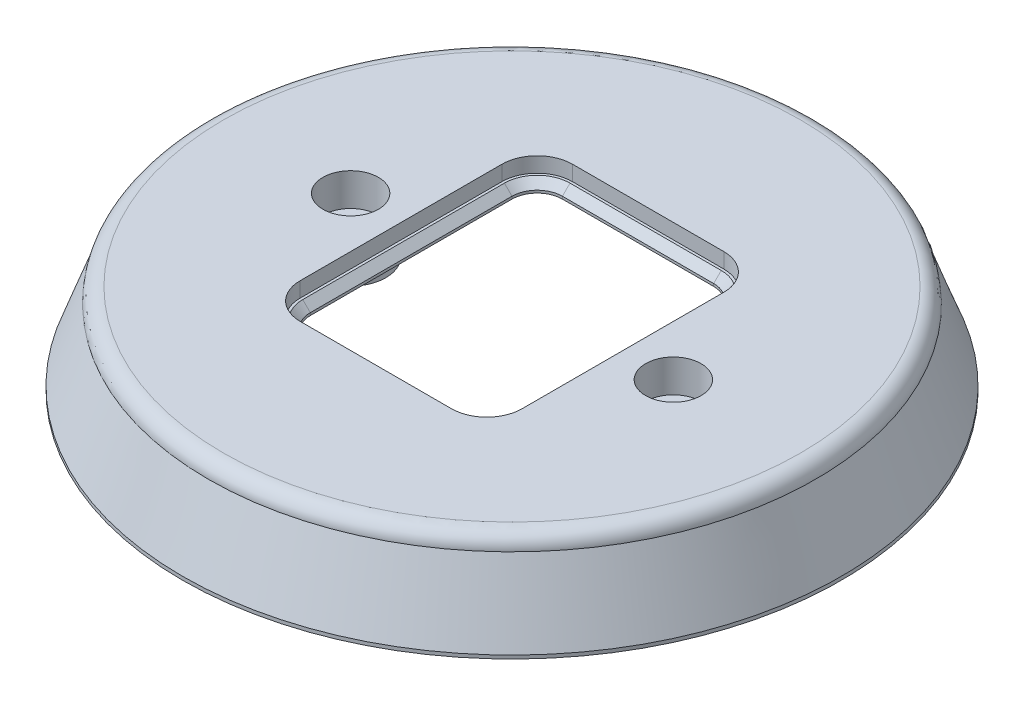
from build123d import *

# Parameters (mm, degrees)
CORTAR_EXTRUIR1_REACH   = 95.608
CROQUIS2_R              = 3.5
CROQUIS3_R              = 7
CROQUIS3_R_2            = 3.5
SALIENTE_EXTRUIR1_DEPTH = 6
SALIENTE_EXTRUIR2_START = 3
CROQUIS4_R              = 60.229990605
CROQUIS4_R_2            = 3.5
SALIENTE_EXTRUIR2_DEPTH = 3
CROQUIS5_R              = 5.5
CORTAR_EXTRUIR2_DEPTH   = 6.5
CORTAR_EXTRUIR3_REACH   = 96.128
CORTAR_EXTRUIR4_DEPTH   = 3
CHAFL_N1_SIZE           = 1.5
REDONDEO1_R             = 3


with BuildPart() as part:
    # Croquis1 → Revolución1 (revolve)
    with BuildSketch(Plane.XY, mode=Mode.PRIVATE) as revoluci_n1_sk:
        Polygon((-65.360292755, 76.904610688), (-65.360292755, 76.220570402), (-63.480907514, 76.220570402), (-58.829575529, 89), (0, 89), (0, 91), (-60.229990605, 91), align=None)
    revolve(revoluci_n1_sk.sketch.rotate(Axis((0, 89, 0), (0, 1, 0)), 270), axis=Axis((0, 89, 0), (0, 1, 0)))

    # Croquis2 → Cortar-Extruir1 (cut, up to next)
    with BuildSketch(Plane(origin=(0, 91, 0), x_dir=(1, 0, 0), z_dir=(0, 1, 0)), mode=Mode.PRIVATE) as cortar_extruir1_sk1:
        with Locations(Location((32, 0, 0), (0, 0, 270))):
            Circle(CROQUIS2_R)
    cortar_extruir1_tool1 = extrude(cortar_extruir1_sk1.sketch, amount=-CORTAR_EXTRUIR1_REACH, mode=Mode.PRIVATE) & part.part
    # Croquis2 → Cortar-Extruir1 (cut, up to next)
    with BuildSketch(Plane(origin=(0, 91, 0), x_dir=(1, 0, 0), z_dir=(0, 1, 0)), mode=Mode.PRIVATE) as cortar_extruir1_sk2:
        with Locations(Location((-32, 0, 0), (0, 0, 270))):
            Circle(CROQUIS2_R)
    cortar_extruir1_tool2 = extrude(cortar_extruir1_sk2.sketch, amount=-CORTAR_EXTRUIR1_REACH, mode=Mode.PRIVATE) & part.part
    add(cortar_extruir1_tool1.solids().sort_by_distance((32, 91, 0))[0], mode=Mode.SUBTRACT)
    add(cortar_extruir1_tool2.solids().sort_by_distance((-32, 91, 0))[0], mode=Mode.SUBTRACT)

    # Croquis3 → Saliente-Extruir1 (add)
    # profile 1 of 2: a face of its own
    with BuildSketch(Plane.XZ.offset(-89)):
        with Locations(Location((-32, 0, 0), (0, 0, 90))):
            Circle(CROQUIS3_R)
        with Locations(Location((-32, 0, 0), (0, 0, 90))):
            Circle(CROQUIS3_R_2, mode=Mode.SUBTRACT)
    # profile 2 of 2: a face of its own
    with BuildSketch(Plane.XZ.offset(-89)):
        with Locations(Location((32, 0, 0), (0, 0, 90))):
            Circle(CROQUIS3_R)
        with Locations(Location((32, 0, 0), (0, 0, 90))):
            Circle(CROQUIS3_R_2, mode=Mode.SUBTRACT)
    extrude(amount=SALIENTE_EXTRUIR1_DEPTH)

    # Croquis4 → Saliente-Extruir2 (add)
    with BuildSketch(Plane(origin=(0, 91, 0), x_dir=(1, 0, 0), z_dir=(0, 1, 0)).offset(SALIENTE_EXTRUIR2_START)):
        with Locations(Location((0, 0, 0), (0, 0, 270))):
            Circle(CROQUIS4_R)
        with Locations(Location((32, 0, 0), (0, 0, 270))):
            Circle(CROQUIS4_R_2, mode=Mode.SUBTRACT)
        with Locations(Location((-32, 0, 0), (0, 0, 270))):
            Circle(CROQUIS4_R_2, mode=Mode.SUBTRACT)
    extrude(amount=-SALIENTE_EXTRUIR2_DEPTH)

    # Croquis5 → Cortar-Extruir2 (cut)
    with BuildSketch(Plane(origin=(0, 94, 0), x_dir=(1, 0, 0), z_dir=(0, 1, 0))):
        with Locations(Location((-32, 0, 0), (0, 0, 270))):
            Circle(CROQUIS5_R)
        with Locations(Location((32, 0, 0), (0, 0, 270))):
            Circle(CROQUIS5_R)
    extrude(amount=-CORTAR_EXTRUIR2_DEPTH, mode=Mode.SUBTRACT)

    # Croquis6 → Cortar-Extruir3 (cut, up to next)
    with BuildSketch(Plane(origin=(0, 94, 0), x_dir=(1, 0, 0), z_dir=(0, 1, 0)), mode=Mode.PRIVATE) as cortar_extruir3_sk1:
        with BuildLine():
            Line((-15, -25), (15, -25))
            ThreePointArc((15, -25), (18.535533906, -23.535533906), (20, -20))
            Line((20, -20), (20, 20))
            ThreePointArc((20, 20), (18.535533906, 23.535533906), (15, 25))
            Line((15, 25), (-15, 25))
            ThreePointArc((-15, 25), (-18.535533906, 23.535533906), (-20, 20))
            Line((-20, 20), (-20, -20))
            ThreePointArc((-20, -20), (-18.535533906, -23.535533906), (-15, -25))
        make_face()
    cortar_extruir3_tool1 = extrude(cortar_extruir3_sk1.sketch, amount=-CORTAR_EXTRUIR3_REACH, mode=Mode.PRIVATE) & part.part
    add(cortar_extruir3_tool1.solids().sort_by_distance((0, 94, 0))[0], mode=Mode.SUBTRACT)

    # Croquis7 → Cortar-Extruir4 (cut)
    with BuildSketch(Plane(origin=(0, 94, 0), x_dir=(1, 0, 0), z_dir=(0, 1, 0))):
        with BuildLine():
            Line((-15, -27), (15, -27))
            ThreePointArc((15, -27), (19.949747468, -24.949747468), (22, -20))
            Line((22, -20), (22, 20))
            ThreePointArc((22, 20), (19.949747468, 24.949747468), (15, 27))
            Line((15, 27), (-15, 27))
            ThreePointArc((-15, 27), (-19.949747468, 24.949747468), (-22, 20))
            Line((-22, 20), (-22, -20))
            ThreePointArc((-22, -20), (-19.949747468, -24.949747468), (-15, -27))
        make_face()
    extrude(amount=-CORTAR_EXTRUIR4_DEPTH, mode=Mode.SUBTRACT)

    # Chaflán1
    chafl_n1_edges = [part.edges().sort_by_distance(p)[0] for p in [
        (0, 91, 25),
        (-18.535533906, 91, 23.535533906),
        (-20, 91, 0),
        (-18.535533906, 91, -23.535533906),
        (0, 91, -25),
        (18.535533906, 91, -23.535533906),
        (20, 91, 0),
        (18.535533906, 91, 23.535533906),
    ]]
    chamfer(chafl_n1_edges, length=CHAFL_N1_SIZE)

    # Redondeo1
    redondeo1_edges = [part.edges().sort_by_distance(p)[0] for p in [
        (0, 94, -60.229990605),
    ]]
    fillet(redondeo1_edges, radius=REDONDEO1_R - 0.0001)  # a hair under: the kernel refuses the full size


solid = part.part
